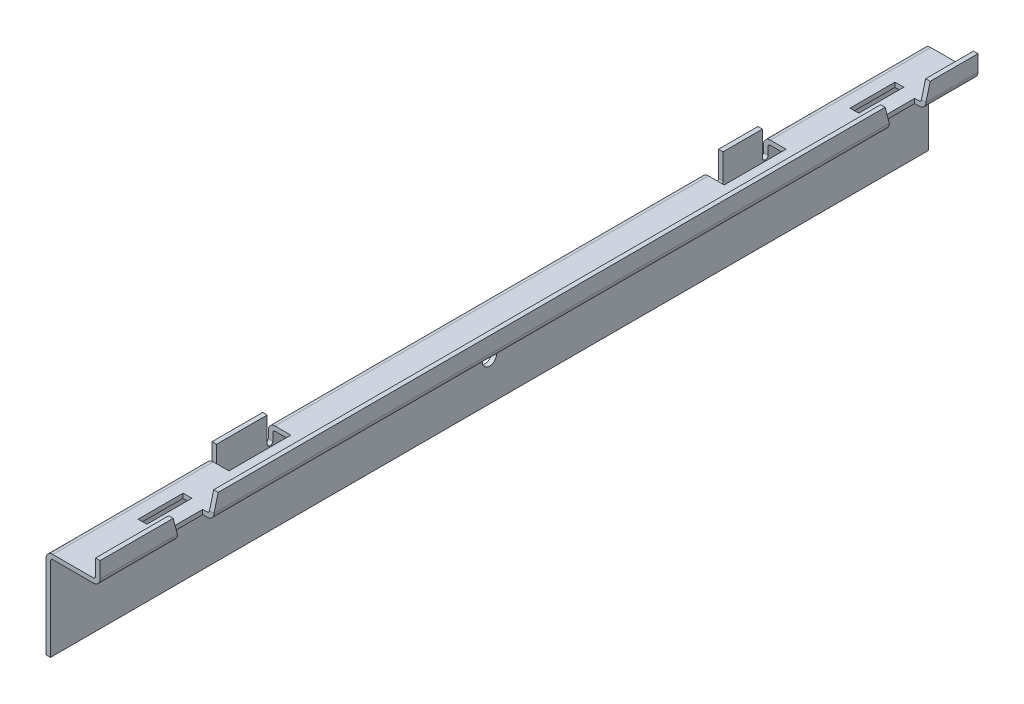
from build123d import *

# Parameters (mm, degrees)
EXTRUDE1_DEPTH     = 247.65
FILLET2_R          = 1.27
FILLET3_R          = 3.81
SKETCH2_W          = 34.925
SKETCH2_H          = 9.525
CUT_EXTRUDE1_DEPTH = 12.7
SKETCH3_W          = 2.54
SKETCH3_H          = 22.225
SKETCH3_H_2        = 28.575
EXTRUDE2_DEPTH     = 15.875
FILLET1_R          = 1.5875
SKETCH4_W          = 4.953
SKETCH4_H          = 25.4
CUT_EXTRUDE2_DEPTH = 2.54
CUT_EXTRUDE3_DEPTH = 6.35
SKETCH6_R          = 3.96875
CUT_EXTRUDE4_DEPTH = 2.54


with BuildPart() as part:
    # Sketch1 → Extrude1 (new, symmetric)
    with BuildSketch(Plane.XY):
        Polygon((-3.512251891, 50.775495097), (-3.512251891, -0.183254903), (-0.972251891, -0.183254903), (-0.972251891, 48.235495097), (26.967748109, 48.235495097), (26.967748109, 61.094245097), (24.427748109, 61.094245097), (24.427748109, 50.775495097), align=None)
    extrude(amount=EXTRUDE1_DEPTH, both=True)

    # Fillet2
    fillet2_edges = [part.edges().sort_by_distance(p)[0] for p in [
        (24.427748109, 50.775495097, 0),
        (-0.972251891, 48.235495097, 0),
    ]]
    fillet(fillet2_edges, radius=FILLET2_R)

    # Fillet3
    fillet3_edges = [part.edges().sort_by_distance(p)[0] for p in [
        (26.967748109, 48.235495097, 0),
        (-3.512251891, 50.775495097, 0),
    ]]
    fillet(fillet3_edges, radius=FILLET3_R)

    # Sketch2 → Cut-Extrude1 (cut)
    with BuildSketch(Plane.ZY.offset(3.512251891)):
        with Locations((-139.7, 46.012995097)):
            Rectangle(SKETCH2_W, SKETCH2_H)
        with Locations((139.7, 46.012995097)):
            Rectangle(SKETCH2_W, SKETCH2_H)
    extrude(amount=-CUT_EXTRUDE1_DEPTH, mode=Mode.SUBTRACT)

    # Sketch3 → Extrude2 (add)
    with BuildSketch(Plane(origin=(0, 41.250495097, 0), x_dir=(1, 0, 0), z_dir=(0, 1, 0))):
        with Locations((-2.242251891, 142.875)):
            Rectangle(SKETCH3_W, SKETCH3_H)
        with Locations((-2.242251891, -139.7)):
            Rectangle(SKETCH3_W, SKETCH3_H_2)
    extrude(amount=EXTRUDE2_DEPTH)

    # Fillet1
    fillet1_edges = [part.edges().sort_by_distance(p)[0] for p in [
        (-2.242251891, 41.250495097, -153.9875),
        (-2.242251891, 41.250495097, -131.7625),
        (-2.242251891, 41.250495097, 125.4125),
        (-2.242251891, 41.250495097, 153.9875),
        (-2.242251891, 41.250495097, -157.1625),
        (-2.242251891, 41.250495097, 157.1625),
        (-2.242251891, 41.250495097, 122.2375),
    ]]
    fillet(fillet1_edges, radius=FILLET1_R - 0.0001)  # a hair under: the kernel refuses the full size

    # Sketch4 → Cut-Extrude2 (cut)
    with BuildSketch(Plane(origin=(0, 50.775495097, 0), x_dir=(1, 0, 0), z_dir=(0, 1, 0))):
        with Locations((9.632248109, 207.9625)):
            Rectangle(SKETCH4_W, SKETCH4_H)
        with Locations((9.632248109, -193.675)):
            Rectangle(SKETCH4_W, SKETCH4_H)
    extrude(amount=-CUT_EXTRUDE2_DEPTH, mode=Mode.SUBTRACT)

    # Sketch5 → Cut-Extrude3 (cut)
    with BuildSketch(Plane(origin=(26.967748109, 0, 0), x_dir=(0, 0, -1), z_dir=(1, 0, 0))):
        Polygon((195.2625, 61.094245097), (220.6625, 61.094245097), (218.28125, 52.045495097), (218.28125, 48.235495097), (197.64375, 48.235495097), (197.64375, 52.045495097), align=None)
        Polygon((-180.975, 61.094245097), (-206.375, 61.094245097), (-203.99375, 52.045495097), (-203.99375, 48.235495097), (-183.35625, 48.235495097), (-183.35625, 52.045495097), align=None)
    extrude(amount=-CUT_EXTRUDE3_DEPTH, mode=Mode.SUBTRACT)

    # Sketch6 → Cut-Extrude4 (cut)
    with BuildSketch(Plane.ZY.offset(3.512251891)):
        with Locations((0, 22.225)):
            Circle(SKETCH6_R)
    extrude(amount=-CUT_EXTRUDE4_DEPTH, mode=Mode.SUBTRACT)


solid = part.part
